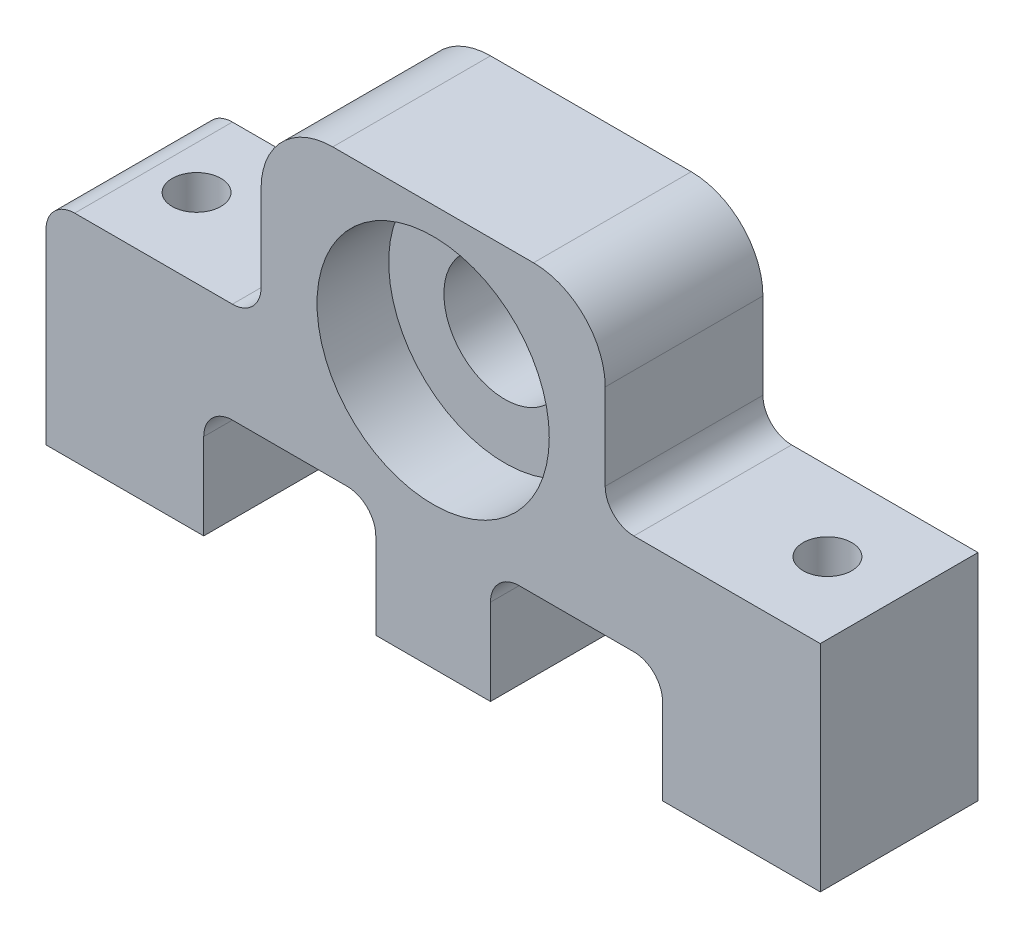
from build123d import *

# Parameters (mm, degrees)
SKETCH_1_W               = 24
SKETCH_1_H               = 28
SKETCH_1_R               = 4.25
EXTRUDE_1_DEPTH          = 11
SKETCH_2_R               = 8.1
CUT_EXTRUDE_1_DEPTH      = 5
SKETCH_6_W               = 15
SKETCH_6_H               = 15
EXTRUDE_2_DEPTH          = 11
CUT_EXTRUDE_3_DEPTH      = 33.787192622
CUT_EXTRUDE_3_DEPTH_BACK = 33.787192622
SKETCH_7_R               = 1.7
SKETCH_8_W               = 12
SKETCH_8_H               = 8
CUT_EXTRUDE_4_DEPTH      = 33.341923258
FILLET_1_R               = 2
FILLET_2_R               = 2
FILLET_3_R               = 5
SKETCH_9_R               = 1.7
EXTRUDE_3_DEPTH          = 25
CUT_EXTRUDE_5_DEPTH      = 25


with BuildPart() as part:
    # 草图1 → 凸台-拉伸1 (new body)
    with BuildSketch(Plane.XY):
        Rectangle(SKETCH_1_W, SKETCH_1_H)
        with Locations((0, 4)):
            Circle(SKETCH_1_R, mode=Mode.SUBTRACT)
    extrude(amount=EXTRUDE_1_DEPTH)

    # 草图2 → 切除-拉伸1 (cut)
    with BuildSketch(Plane.XY.offset(11)):
        with Locations((0, 4)):
            Circle(SKETCH_2_R)
    extrude(amount=-CUT_EXTRUDE_1_DEPTH, mode=Mode.SUBTRACT)

    # 草图6 → 凸台-拉伸2 (add)
    with BuildSketch(Plane.XY.offset(11)):
        with Locations((-19.5, -6.5)):
            Rectangle(SKETCH_6_W, SKETCH_6_H)
        with Locations((19.5, -6.5)):
            Rectangle(SKETCH_6_W, SKETCH_6_H)
    extrude(amount=-EXTRUDE_2_DEPTH)

    # 草图7 → 切除-拉伸3 (cut, two sides: drawn at the far end of the back side and taken through both)
    with BuildSketch(Plane(origin=(0, 1, 0), x_dir=(1, 0, 0), z_dir=(0, 1, 0)).offset(-CUT_EXTRUDE_3_DEPTH_BACK)):
        with Locations(Location((22, -5.5, 0), (0, 0, 180))):
            Circle(SKETCH_7_R)
        with Locations(Location((-22, -5.5, 0), (0, 0, 180))):
            Circle(SKETCH_7_R)
        with Locations(Location((10.5, -5.5, 0), (0, 0, 180))):
            Circle(SKETCH_7_R)
    extrude(amount=CUT_EXTRUDE_3_DEPTH + CUT_EXTRUDE_3_DEPTH_BACK, mode=Mode.SUBTRACT)

    # 草图8 → 切除-拉伸4 (cut, through all)
    with BuildSketch(Plane.XY.offset(11)):
        with Locations((-10, -10)):
            Rectangle(SKETCH_8_W, SKETCH_8_H)
        with Locations((10, -10)):
            Rectangle(SKETCH_8_W, SKETCH_8_H)
    extrude(amount=-CUT_EXTRUDE_4_DEPTH, mode=Mode.SUBTRACT)

    # 圆角1
    fillet_1_edges = [part.edges().sort_by_distance(p)[0] for p in [
        (-16, -6, 5.5),
        (-4, -6, 5.5),
        (4, -6, 5.5),
        (16, -6, 5.5),
    ]]
    fillet(fillet_1_edges, radius=FILLET_1_R)

    # 圆角2
    # the kernel refuses this fillet: 2 mm, written as the material it adds along each edge
    with BuildSketch(Plane(origin=(12, 1, 11), x_dir=(1, 0, 0), z_dir=(0, 0, -1))) as fillet_2_piece_1_section:
        with BuildLine():
            CenterArc((FILLET_2_R, -FILLET_2_R), FILLET_2_R, 90, 90)
            Line((0, -FILLET_2_R), (0, 0))
            Line((0, 0), (FILLET_2_R, 0))
        make_face()
    fillet_2_piece_1 = extrude(amount=9.7, mode=Mode.PRIVATE)
    fillet_2_piece_1 = fillet_2_piece_1 - Plane(origin=(10.5, 1.435440369, 5.5), x_dir=(-1, 0, 0), z_dir=(0, -1, 0)) * Cylinder(1.7, 28, mode=Mode.PRIVATE)
    add(fillet_2_piece_1)
    with BuildSketch(Plane(origin=(12, 1, 9.7), x_dir=(0, 1, 0), z_dir=(0, 0, -1))) as fillet_2_piece_2_section:
        with BuildLine():
            CenterArc((FILLET_2_R, FILLET_2_R), FILLET_2_R, 180, 90)
            Line((0, FILLET_2_R), (0, 0))
            Line((0, 0), (FILLET_2_R, 0))
        make_face()
    fillet_2_piece_2 = extrude(amount=9.7, mode=Mode.PRIVATE)
    fillet_2_piece_2 = fillet_2_piece_2 - Plane(origin=(10.5, 1.435440365, 5.5), x_dir=(-1, 0, 0), z_dir=(0, -1, 0)) * Cylinder(1.7, 28, mode=Mode.PRIVATE)
    add(fillet_2_piece_2)
    with BuildSketch(Plane(origin=(-12, 1, 11), x_dir=(-1, 0, 0), z_dir=(0, 0, -1))) as fillet_2_piece_3:
        with BuildLine():
            CenterArc((FILLET_2_R, FILLET_2_R), FILLET_2_R, 180, 90)
            Line((0, FILLET_2_R), (0, 0))
            Line((0, 0), (FILLET_2_R, 0))
        make_face()
    extrude(amount=11)
    # the kernel refuses this fillet: 2 mm, written as the material it takes off along each edge
    with BuildSketch(Plane(origin=(-27, 1, 16), x_dir=(0, -1, 0), z_dir=(0, 0, -1))) as fillet_2_2_piece_1:
        with BuildLine():
            CenterArc((FILLET_2_R, -FILLET_2_R), FILLET_2_R, 90, 90)
            Line((0, -FILLET_2_R), (0, 0))
            Line((0, 0), (FILLET_2_R, 0))
        make_face()
    extrude(amount=21, mode=Mode.SUBTRACT)

    # 圆角3
    # the kernel refuses this fillet: 5 mm, written as the material it takes off along each edge
    with BuildSketch(Plane(origin=(12, 14, -6.2), x_dir=(-1, 0, 0), z_dir=(0, 0, 1))) as fillet_3_piece_1:
        with BuildLine():
            CenterArc((FILLET_3_R, FILLET_3_R), FILLET_3_R, 180, 90)
            Line((0, FILLET_3_R), (0, 0))
            Line((0, 0), (FILLET_3_R, 0))
        make_face()
    extrude(amount=29.7, mode=Mode.SUBTRACT)
    with BuildSketch(Plane(origin=(-12, 14, -12.5), x_dir=(0, -1, 0), z_dir=(0, 0, 1))) as fillet_3_piece_2:
        with BuildLine():
            CenterArc((FILLET_3_R, FILLET_3_R), FILLET_3_R, 180, 90)
            Line((0, FILLET_3_R), (0, 0))
            Line((0, 0), (FILLET_3_R, 0))
        make_face()
    extrude(amount=36, mode=Mode.SUBTRACT)

    # 草图9 → 凸台-拉伸3 (add)
    with BuildSketch(Plane.XZ.offset(6)):
        with Locations((10.5, 5.5)):
            Circle(SKETCH_9_R)
    extrude(amount=-EXTRUDE_3_DEPTH)

    # 草图10 → 切除-拉伸5 (cut)
    with BuildSketch(Plane.XY.offset(11)):
        with BuildLine():
            Line((12, 3), (12, 9))
            ThreePointArc((12, 9), (10.535533906, 12.535533906), (7, 14))
            Line((7, 14), (7.594175957, 21.794622096))
            Line((7.594175957, 21.794622096), (15.452945432, 21.794622096))
            Line((15.452945432, 21.794622096), (16.462328667, 6.870169973))
            Line((16.462328667, 6.870169973), (14, 1))
            ThreePointArc((14, 1), (12.585786438, 1.585786438), (12, 3))
        make_face()
    extrude(amount=-CUT_EXTRUDE_5_DEPTH, mode=Mode.SUBTRACT)


solid = part.part
